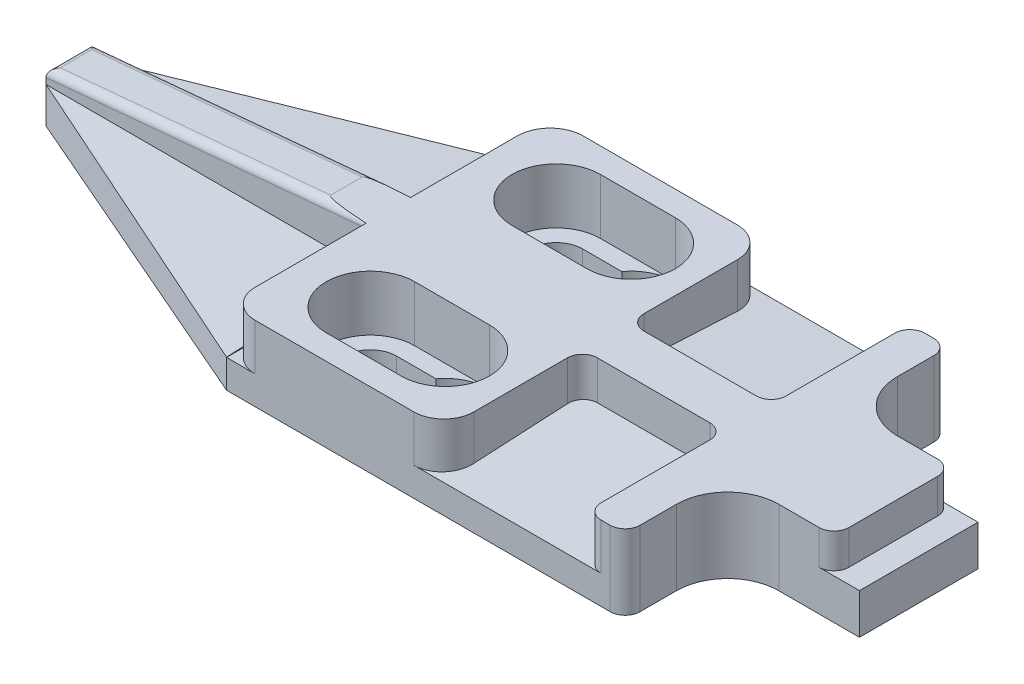
from build123d import *
from OCP.BRepAlgoAPI import BRepAlgoAPI_Cut
from OCP.TopTools import TopTools_ListOfShape

# Parameters (mm, degrees)
SKETCH1_W           = 72.009
SKETCH1_H           = 6.35
BOSS_EXTRUDE1_DEPTH = 27.432
CUT_EXTRUDE2_DEPTH  = 64.822827375
SKETCH4_W           = 12.065
SKETCH4_H           = 11.7475
CUT_EXTRUDE3_DEPTH  = 3.937
SKETCH5_W           = 27.051
SKETCH5_H           = 11.7475
CUT_EXTRUDE4_DEPTH  = 3.937
SKETCH6_W           = 2.159
SKETCH6_H           = 10.0457
CUT_EXTRUDE5_DEPTH  = 2.921
CHAMFER1_SIZE       = 0.635
CHAMFER1_SIZE_2     = 12.116521797
CHAMFER2_SIZE       = 12.116521797
CHAMFER2_SIZE_2     = 0.635
CHAMFER3_SIZE       = 0.615660387
CHAMFER3_SIZE_2     = 11.7475
CUT_EXTRUDE8_DEPTH  = 64.822827375
CUT_EXTRUDE10_DEPTH = 62.361435951
FILLET1_R           = 2.54
FILLET2_R           = 2.54
FILLET5_R           = 1.27
FILLET6_R           = 1.27
FILLET10_R          = 1.27
CUT_EXTRUDE11_START = -3.937
CUT_EXTRUDE11_DEPTH = 4.937
SKETCH17_R          = 2.2225
CUT_EXTRUDE12_DEPTH = 64.82283009
CUT_EXTRUDE13_START = -4.699
SKETCH18_R          = 3.7465
SKETCH18_R_2        = 2.2225
CUT_EXTRUDE13_DEPTH = 4.699
SKETCH19_R          = 3.7465
CUT_EXTRUDE14_DEPTH = 64.679759278
SKETCH20_W          = 4.845296959
SKETCH20_H          = 4.445
CUT_EXTRUDE15_DEPTH = 64.679759278
FILLET12_R          = 0.635


with BuildPart() as part:
    # Sketch1 → Boss-Extrude1 (new body)
    with BuildSketch(Plane.XY):
        with Locations((-21.271290436, -12.275116881)):
            Rectangle(SKETCH1_W, SKETCH1_H)
    extrude(amount=-BOSS_EXTRUDE1_DEPTH)

    # Sketch3 → Cut-Extrude2 (cut, through all)
    with BuildSketch(Plane(origin=(0, -9.100116881, 0), x_dir=(1, 0, 0), z_dir=(0, 1, 0))):
        with BuildLine():
            ThreePointArc((3.550859564, 23.08225), (4.824871842, 20.006512279), (7.900609564, 18.7325))
            Line((7.900609564, 18.7325), (14.733209564, 18.7325))
            Line((14.733209564, 18.7325), (14.733209564, 27.432))
            Line((14.733209564, 27.432), (3.557209564, 27.432))
            Line((3.557209564, 27.432), (3.550859564, 23.08225))
        make_face()
        with BuildLine():
            Line((14.733209564, 0), (14.733209564, 8.6868))
            Line((14.733209564, 8.6868), (7.900609564, 8.6868))
            ThreePointArc((7.900609564, 8.6868), (4.82936197, 7.414647593), (3.557209564, 4.3434))
            Line((3.557209564, 4.3434), (3.557209564, 0))
            Line((3.557209564, 0), (14.733209564, 0))
        make_face()
    extrude(amount=-CUT_EXTRUDE2_DEPTH, mode=Mode.SUBTRACT)

    # Sketch4 → Cut-Extrude3 (cut)
    with BuildSketch(Plane(origin=(0, -9.100116881, 0), x_dir=(1, 0, 0), z_dir=(0, 1, 0))):
        with Locations((-5.777290436, 21.55825)):
            Rectangle(SKETCH4_W, SKETCH4_H)
        with Locations((-5.777290436, 5.87375)):
            Rectangle(SKETCH4_W, SKETCH4_H)
    extrude(amount=-CUT_EXTRUDE3_DEPTH, mode=Mode.SUBTRACT)

    # Sketch5 → Cut-Extrude4 (cut)
    with BuildSketch(Plane(origin=(0, -9.100116881, 0), x_dir=(1, 0, 0), z_dir=(0, 1, 0))):
        with Locations((-43.750290436, 21.55825)):
            Rectangle(SKETCH5_W, SKETCH5_H)
        with Locations((-43.750290436, 5.87375)):
            Rectangle(SKETCH5_W, SKETCH5_H)
    extrude(amount=-CUT_EXTRUDE4_DEPTH, mode=Mode.SUBTRACT)

    # Sketch6 → Cut-Extrude5 (cut)
    with BuildSketch(Plane(origin=(0, -9.100116881, 0), x_dir=(1, 0, 0), z_dir=(0, 1, 0))):
        with Locations((13.653709564, 13.70965)):
            Rectangle(SKETCH6_W, SKETCH6_H)
    extrude(amount=-CUT_EXTRUDE5_DEPTH, mode=Mode.SUBTRACT)

    # Chamfer1
    # the kernel refuses this chamfer: 12.116521797, 0.635 mm, written as the material it adds along each edge
    with BuildSketch(Plane(origin=(-43.311150406, -13.037116881, -11.7475), x_dir=(0, 1, 0), z_dir=(1, 0, 0))) as chamfer1_piece_1_section:
        Polygon((CHAMFER1_SIZE, 0), (0, CHAMFER1_SIZE_2), (0, 0), align=None)
    chamfer1_piece_1 = extrude(amount=75.06771994, mode=Mode.PRIVATE)
    chamfer1_piece_1 = split(chamfer1_piece_1, bisect_by=Plane(origin=(-43.311150406, -13.037116881, 0), z_dir=(0, 0, -1)), keep=Keep.TOP, mode=Mode.PRIVATE)
    chamfer1_piece_1 = split(chamfer1_piece_1, bisect_by=Plane(origin=(3.557209564, -13.037116881, -11.7475), z_dir=(-1, 0, 0)), keep=Keep.TOP, mode=Mode.PRIVATE)
    add(chamfer1_piece_1)
    with BuildSketch(Plane(origin=(1.276569534, -13.037116881, -11.7475), x_dir=(0, 1, 0), z_dir=(-1, 0, 0))) as chamfer1_piece_2_section:
        Polygon((CHAMFER1_SIZE, 0), (0, -CHAMFER1_SIZE_2), (0, 0), align=None)
    chamfer1_piece_2 = extrude(amount=58.55235997, mode=Mode.PRIVATE)
    chamfer1_piece_2 = split(chamfer1_piece_2, bisect_by=Plane(origin=(1.276569534, -13.037116881, 0), z_dir=(0, 0, -1)), keep=Keep.TOP, mode=Mode.PRIVATE)
    add(chamfer1_piece_2)

    # Chamfer2
    # the kernel refuses this chamfer: 12.116521797, 0.635 mm, written as the material it adds along each edge
    with BuildSketch(Plane(origin=(-11.809790436, -13.037116881, -15.6845), x_dir=(0, 0, -1), z_dir=(1, 0, 0))) as chamfer2_piece_1_section:
        Polygon((CHAMFER2_SIZE, 0), (0, CHAMFER2_SIZE_2), (0, 0), align=None)
    chamfer2_piece_1 = extrude(amount=43.56635997, mode=Mode.PRIVATE)
    chamfer2_piece_1 = split(chamfer2_piece_1, bisect_by=Plane(origin=(-11.809790436, -13.037116881, -27.432), z_dir=(0, 0, 1)), keep=Keep.TOP, mode=Mode.PRIVATE)
    chamfer2_piece_1 = split(chamfer2_piece_1, bisect_by=Plane(origin=(3.540027216, -13.037116881, -15.662091507), z_dir=(-0.9999989344148313, 0, -0.0014598524589999236)), keep=Keep.TOP, mode=Mode.PRIVATE)
    add(chamfer2_piece_1)

    # Chamfer3
    # the kernel refuses this chamfer: 11.7475, 0.615660387 mm, written as the material it adds along each edge
    with BuildSketch(Plane(origin=(-57.275790436, -13.037116881, -15.6845), x_dir=(0, 1, 0), z_dir=(1, 0, 0))) as chamfer3_piece_1:
        Polygon((CHAMFER3_SIZE, 0), (0, -CHAMFER3_SIZE_2), (0, 0), align=None)
    extrude(amount=57.592951928)

    # Sketch14 → Cut-Extrude8 (cut, through all)
    with BuildSketch(Plane.XZ.offset(15.450116881)):
        Polygon((-30.224790436, 0), (-57.275790436, -11.7475), (-57.275790436, 0), align=None)
        Polygon((-30.224790436, -27.432), (-57.275790436, -15.6845), (-57.275790436, -27.432), align=None)
    extrude(amount=-CUT_EXTRUDE8_DEPTH, mode=Mode.SUBTRACT)

    # Sketch15 → Cut-Extrude10 (cut, through all)
    with BuildSketch(Plane.XY.offset(-11.7475)):
        Polygon((-57.275790436, -9.100116881), (-33.780790436, -9.100116881), (-57.275790436, -11.259116881), align=None)
    extrude(amount=-CUT_EXTRUDE10_DEPTH, mode=Mode.SUBTRACT)

    # Fillet1
    fillet1_edges = [part.edges().sort_by_distance(p)[0] for p in [
        (-11.809790436, -11.058947074, -27.432),
    ]]
    fillet(fillet1_edges, radius=FILLET1_R)

    # Fillet2
    fillet2_edges = [part.edges().sort_by_distance(p)[0] for p in [
        (-11.809790436, -11.058947074, 0),
    ]]
    fillet(fillet2_edges, radius=FILLET2_R)

    # Fillet5
    fillet5_edges = [part.edges().sort_by_distance(p)[0] for p in [
        (0.255209564, -11.058947074, 0),
        (0.255209564, -11.058947074, -27.432),
        (3.557209564, -12.275116881, -27.432),
        (3.557209564, -12.275116881, 0),
    ]]
    fillet(fillet5_edges, radius=FILLET5_R)

    # Fillet6
    fillet6_edges = [part.edges().sort_by_distance(p)[0] for p in [
        (12.574209564, -10.560616881, -8.6868),
        (12.574209564, -10.560616881, -18.7325),
    ]]
    fillet(fillet6_edges, radius=FILLET6_R)

    # Fillet10
    fillet10_edges = [part.edges().sort_by_distance(p)[0] for p in [
        (-11.809790436, -10.751116881, -11.7475),
        (0.255209564, -10.751116881, -11.7475),
        (0.255209564, -10.751116881, -15.6845),
        (-11.809790436, -10.751116881, -15.6845),
    ]]
    fillet(fillet10_edges, radius=FILLET10_R)


with BuildPart() as cut_extrude11_tool:
    # Cut-Extrude11: read off the stored shape, not the designer's step
    # Cut-Extrude11 outline → Cut-Extrude11 (new body)
    with BuildSketch(Plane(origin=(0, -9.100116881, 0), x_dir=(1, 0, 0), z_dir=(0, 1, 0)).offset(CUT_EXTRUDE11_START)):
        with BuildLine():
            Line((-27.423682508, 27.432006318), (-30.224790436, 27.432))
            Line((-30.224790436, 27.432), (-30.224790436, 24.636841581))
            ThreePointArc((-30.224790436, 24.636841581), (-29.402264799, 26.613681304), (-27.423682508, 27.432006318))
        make_face()
        with BuildLine():
            ThreePointArc((-27.804330441, -3.203e-06), (-29.514463685, 0.70754249), (-30.224790436, 2.416522456))
            Line((-30.224790436, 2.416522456), (-30.224790436, 0))
            Line((-30.224790436, 0), (-27.804330441, -3.203e-06))
        make_face()
    extrude(amount=CUT_EXTRUDE11_DEPTH)


with BuildPart() as part_1:
    add(part.part)

    # Cut-Extrude11: cut by cut_extrude11_tool, with a tolerance
    cut_extrude11_stock = TopTools_ListOfShape()
    cut_extrude11_stock.Append(part_1.part.wrapped)
    cut_extrude11_tools = TopTools_ListOfShape()
    cut_extrude11_tools.Append(cut_extrude11_tool.part.wrapped)
    cut_extrude11_cut = BRepAlgoAPI_Cut()
    cut_extrude11_cut.SetArguments(cut_extrude11_stock)
    cut_extrude11_cut.SetTools(cut_extrude11_tools)
    cut_extrude11_cut.SetFuzzyValue(0.00001)
    cut_extrude11_cut.Build()
    add(Compound.cast(cut_extrude11_cut.Shape()).solids(), mode=Mode.REPLACE)

    # Sketch17 → Cut-Extrude12 (cut, through all)
    with BuildSketch(Plane.XZ.offset(15.450116881)):
        with Locations(Location((-23.874790436, -5.842, 0), (0, 0, 270))):
            Circle(SKETCH17_R)
        with Locations(Location((-23.874790436, -21.59, 0), (0, 0, 270))):
            Circle(SKETCH17_R)
    extrude(amount=-CUT_EXTRUDE12_DEPTH, mode=Mode.SUBTRACT)

    # Sketch18 → Cut-Extrude13 (cut)
    # profile 1 of 16: a face of its own
    with BuildSketch(Plane(origin=(0, -9.100116881, 0), x_dir=(1, 0, 0), z_dir=(0, 1, 0)).offset(CUT_EXTRUDE13_START)):
        with Locations((-17.524790436, 21.59)):
            Circle(SKETCH18_R)
    # profile 2 of 16: a face of its own
    with BuildSketch(Plane(origin=(0, -9.100116881, 0), x_dir=(1, 0, 0), z_dir=(0, 1, 0)).offset(CUT_EXTRUDE13_START)):
        with Locations((-23.874790436, 21.59)):
            Circle(SKETCH18_R)
        with Locations(Location((-23.874790436, 21.59, 0), (0, 0, 90))):
            Circle(SKETCH18_R_2, mode=Mode.SUBTRACT)
    # profile 3 of 16: a face of its own
    with BuildSketch(Plane(origin=(0, -9.100116881, 0), x_dir=(1, 0, 0), z_dir=(0, 1, 0)).offset(CUT_EXTRUDE13_START)):
        with BuildLine():
            Line((-17.524790436, 25.3365), (-23.874790436, 25.3365))
            ThreePointArc((-23.874790436, 25.3365), (-22.060275437, 24.867773264), (-20.699790436, 23.57887839))
            ThreePointArc((-20.699790436, 23.57887839), (-19.339305435, 24.867773264), (-17.524790436, 25.3365))
        make_face()
    # profile 4 of 16: a face of its own
    with BuildSketch(Plane(origin=(0, -9.100116881, 0), x_dir=(1, 0, 0), z_dir=(0, 1, 0)).offset(CUT_EXTRUDE13_START)):
        with Locations((-17.524790436, 21.59)):
            Circle(SKETCH18_R)
    # profile 5 of 16: a face of its own
    with BuildSketch(Plane(origin=(0, -9.100116881, 0), x_dir=(1, 0, 0), z_dir=(0, 1, 0)).offset(CUT_EXTRUDE13_START)):
        with Locations((-23.874790436, 21.59)):
            Circle(SKETCH18_R)
    # profile 6 of 16: a face of its own
    with BuildSketch(Plane(origin=(0, -9.100116881, 0), x_dir=(1, 0, 0), z_dir=(0, 1, 0)).offset(CUT_EXTRUDE13_START)):
        with BuildLine():
            ThreePointArc((-20.699790436, 19.60112161), (-22.060275437, 18.312226736), (-23.874790436, 17.8435))
            Line((-23.874790436, 17.8435), (-17.524790436, 17.8435))
            ThreePointArc((-17.524790436, 17.8435), (-19.339305435, 18.312226736), (-20.699790436, 19.60112161))
        make_face()
    # profile 7 of 16: a face of its own
    with BuildSketch(Plane(origin=(0, -9.100116881, 0), x_dir=(1, 0, 0), z_dir=(0, 1, 0)).offset(CUT_EXTRUDE13_START)):
        with Locations((-23.874790436, 21.59)):
            Circle(SKETCH18_R)
    # profile 8 of 16: a face of its own
    with BuildSketch(Plane(origin=(0, -9.100116881, 0), x_dir=(1, 0, 0), z_dir=(0, 1, 0)).offset(CUT_EXTRUDE13_START)):
        with Locations((-17.524790436, 21.59)):
            Circle(SKETCH18_R)
    # profile 9 of 16: a face of its own
    with BuildSketch(Plane(origin=(0, -9.100116881, 0), x_dir=(1, 0, 0), z_dir=(0, 1, 0)).offset(CUT_EXTRUDE13_START)):
        with Locations((-17.524790436, 5.842)):
            Circle(SKETCH18_R)
    # profile 10 of 16: a face of its own
    with BuildSketch(Plane(origin=(0, -9.100116881, 0), x_dir=(1, 0, 0), z_dir=(0, 1, 0)).offset(CUT_EXTRUDE13_START)):
        with Locations((-23.874790436, 5.842)):
            Circle(SKETCH18_R)
        with Locations(Location((-23.874790436, 5.842, 0), (0, 0, 90))):
            Circle(SKETCH18_R_2, mode=Mode.SUBTRACT)
    # profile 11 of 16: a face of its own
    with BuildSketch(Plane(origin=(0, -9.100116881, 0), x_dir=(1, 0, 0), z_dir=(0, 1, 0)).offset(CUT_EXTRUDE13_START)):
        with BuildLine():
            Line((-17.524790436, 9.5885), (-23.874790436, 9.5885))
            ThreePointArc((-23.874790436, 9.5885), (-22.060275437, 9.119773264), (-20.699790436, 7.83087839))
            ThreePointArc((-20.699790436, 7.83087839), (-19.339305435, 9.119773264), (-17.524790436, 9.5885))
        make_face()
    # profile 12 of 16: a face of its own
    with BuildSketch(Plane(origin=(0, -9.100116881, 0), x_dir=(1, 0, 0), z_dir=(0, 1, 0)).offset(CUT_EXTRUDE13_START)):
        with Locations((-17.524790436, 5.842)):
            Circle(SKETCH18_R)
    # profile 13 of 16: a face of its own
    with BuildSketch(Plane(origin=(0, -9.100116881, 0), x_dir=(1, 0, 0), z_dir=(0, 1, 0)).offset(CUT_EXTRUDE13_START)):
        with Locations((-23.874790436, 5.842)):
            Circle(SKETCH18_R)
    # profile 14 of 16: a face of its own
    with BuildSketch(Plane(origin=(0, -9.100116881, 0), x_dir=(1, 0, 0), z_dir=(0, 1, 0)).offset(CUT_EXTRUDE13_START)):
        with Locations((-23.874790436, 5.842)):
            Circle(SKETCH18_R)
    # profile 15 of 16: a face of its own
    with BuildSketch(Plane(origin=(0, -9.100116881, 0), x_dir=(1, 0, 0), z_dir=(0, 1, 0)).offset(CUT_EXTRUDE13_START)):
        with Locations((-17.524790436, 5.842)):
            Circle(SKETCH18_R)
    # profile 16 of 16: a face of its own
    with BuildSketch(Plane(origin=(0, -9.100116881, 0), x_dir=(1, 0, 0), z_dir=(0, 1, 0)).offset(CUT_EXTRUDE13_START)):
        with BuildLine():
            ThreePointArc((-20.699790436, 3.85312161), (-22.060275437, 2.564226736), (-23.874790436, 2.0955))
            Line((-23.874790436, 2.0955), (-17.524790436, 2.0955))
            ThreePointArc((-17.524790436, 2.0955), (-19.339305435, 2.564226736), (-20.699790436, 3.85312161))
        make_face()
    extrude(amount=CUT_EXTRUDE13_DEPTH, mode=Mode.SUBTRACT)

    # Sketch19 → Cut-Extrude14 (cut, through all)
    with BuildSketch(Plane(origin=(0, -13.799116881, 0), x_dir=(1, 0, 0), z_dir=(0, 1, 0))):
        with BuildLine():
            Line((-20.540873326, 23.8125), (-23.874790436, 23.8125))
            ThreePointArc((-23.874790436, 23.8125), (-21.652290436, 21.59), (-23.874790436, 19.3675))
            Line((-23.874790436, 19.3675), (-20.540873326, 19.3675))
            ThreePointArc((-20.540873326, 19.3675), (-13.778290436, 21.59), (-20.540873326, 23.8125))
        make_face()
        with Locations(Location((-17.524790436, 5.842, 0), (0, 0, 270))):
            Circle(SKETCH19_R)
    extrude(amount=-CUT_EXTRUDE14_DEPTH, mode=Mode.SUBTRACT)

    # Sketch20 → Cut-Extrude15 (cut, through all)
    with BuildSketch(Plane(origin=(0, -13.799116881, 0), x_dir=(1, 0, 0), z_dir=(0, 1, 0))):
        with Locations((-21.452141957, 5.842)):
            Rectangle(SKETCH20_W, SKETCH20_H)
    extrude(amount=-CUT_EXTRUDE15_DEPTH, mode=Mode.SUBTRACT)

    # Fillet12
    # the kernel refuses this fillet: 0.635 mm, written as the material it takes off along each edge
    with BuildSketch(Plane(origin=(-57.275790436, -11.259116881, -10.299189948), x_dir=(0.9958044920127651, 0.09150635872549404, 0), z_dir=(0, 0, -1))) as fillet12_piece_1:
        with BuildLine():
            CenterArc((FILLET12_R * 0.912321292544, FILLET12_R), FILLET12_R, 185.25027273, 84.74972727)
            Line((-FILLET12_R * 0.0834831994685, FILLET12_R * 0.908493641275), (0, 0))
            Line((0, 0), (FILLET12_R * 0.912321292544, 0))
        make_face()
    extrude(amount=6.833620104, mode=Mode.SUBTRACT)
    with BuildSketch(Plane(origin=(-25.876592281, -8.373785158, -15.6845), x_dir=(0, 0, 1), z_dir=(-0.9958044920127651, -0.09150635872549373, 0))) as fillet12_piece_2_section:
        with BuildLine():
            CenterArc((FILLET12_R, -FILLET12_R), FILLET12_R, 90, 90)
            Line((0, -FILLET12_R), (0, 0))
            Line((0, 0), (FILLET12_R, 0))
        make_face()
    fillet12_piece_2 = extrude(amount=33.118988768, mode=Mode.PRIVATE)
    fillet12_piece_2 = split(fillet12_piece_2, bisect_by=Plane(origin=(-30.224790436, -8.373785158, -15.6845), z_dir=(-1, 0, 0)), keep=Keep.TOP, mode=Mode.PRIVATE)
    add(fillet12_piece_2, mode=Mode.SUBTRACT)
    with BuildSketch(Plane(origin=(-25.876592281, -8.373785158, -11.7475), x_dir=(0.09150635872549373, -0.9958044920127651, 1.3987061727561039e-14), z_dir=(-0.9958044920127651, -0.09150635872549373, 0))) as fillet12_piece_3_section:
        with BuildLine():
            CenterArc((FILLET12_R, -FILLET12_R), FILLET12_R, 90, 90)
            Line((0, -FILLET12_R), (0, 0))
            Line((0, 0), (FILLET12_R, 0))
        make_face()
    fillet12_piece_3 = extrude(amount=33.118988768, mode=Mode.PRIVATE)
    fillet12_piece_3 = split(fillet12_piece_3, bisect_by=Plane(origin=(-30.224790436, -8.373785158, -11.7475), z_dir=(-1, 0, 0)), keep=Keep.TOP, mode=Mode.PRIVATE)
    add(fillet12_piece_3, mode=Mode.SUBTRACT)


solid = part_1.part
